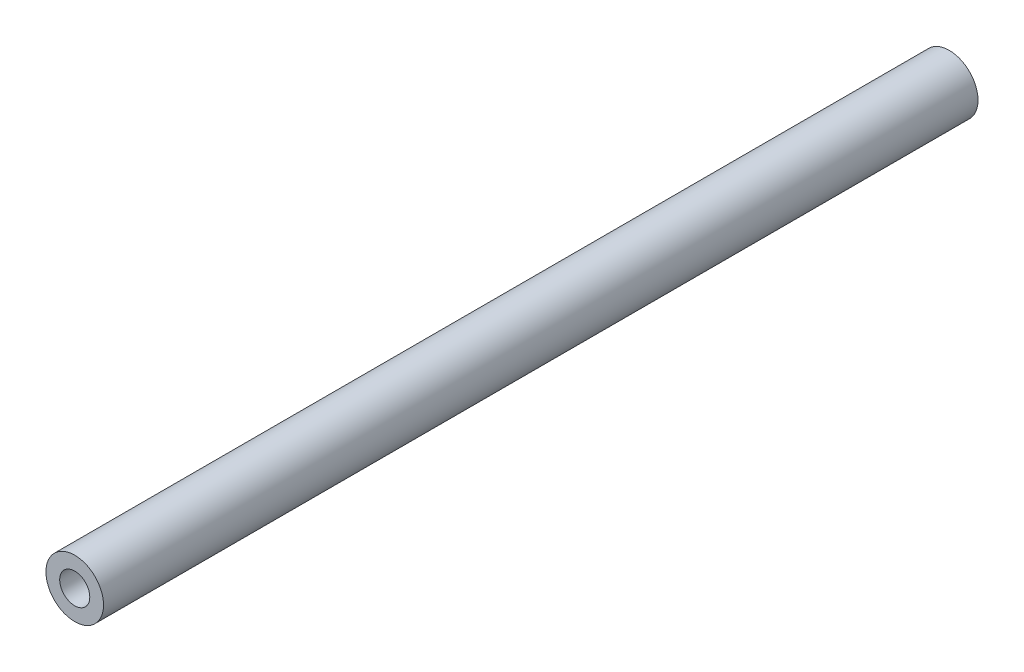
from build123d import *

# Parameters (mm, degrees)
SKETCH1_R           = 4.7625
SKETCH1_R_2         = 2.4892
BOSS_EXTRUDE1_DEPTH = 144.6784


with BuildPart() as part:
    # Sketch1 → Boss-Extrude1 (new body)
    with BuildSketch(Plane.XY):
        Circle(SKETCH1_R)
        Circle(SKETCH1_R_2, mode=Mode.SUBTRACT)
    extrude(amount=-BOSS_EXTRUDE1_DEPTH)


solid = part.part
